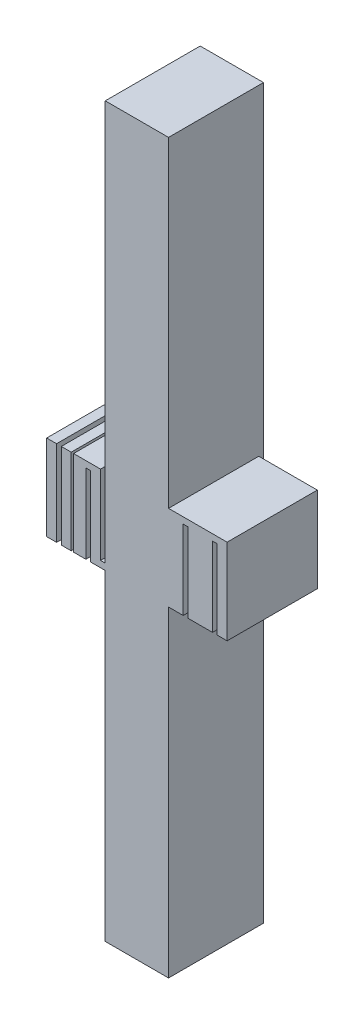
from build123d import *

# Parameters (mm, degrees)
SKETCH1_W           = 20
SKETCH1_H           = 230
BOSS_EXTRUDE1_DEPTH = 30
SKETCH2_W           = 18.5
SKETCH2_H           = 27
BOSS_EXTRUDE2_DEPTH = 28.5
SKETCH3_W           = 1.5
SKETCH3_H           = 25
CUT_EXTRUDE1_DEPTH  = 28.5
SKETCH4_W           = 1.5
SKETCH4_H           = 25
SKETCH4_W_2         = 0.75
SKETCH4_H_2         = 27
CUT_EXTRUDE2_DEPTH  = 28.5


with BuildPart() as part:
    # Sketch1 → Boss-Extrude1 (new body)
    with BuildSketch(Plane.XY):
        Rectangle(SKETCH1_W, SKETCH1_H)
    extrude(amount=-BOSS_EXTRUDE1_DEPTH)

    # Sketch2 → Boss-Extrude2 (add)
    with BuildSketch(Plane.XY):
        with Locations((-19.25, 0)):
            Rectangle(SKETCH2_W, SKETCH2_H)
        with Locations((19.25, 0)):
            Rectangle(SKETCH2_W, SKETCH2_H)
    extrude(amount=-BOSS_EXTRUDE2_DEPTH)

    # Sketch3 → Cut-Extrude1 (cut)
    with BuildSketch(Plane.XY):
        with Locations((-10.75, 1)):
            Rectangle(SKETCH3_W, SKETCH3_H)
    extrude(amount=-CUT_EXTRUDE1_DEPTH, mode=Mode.SUBTRACT)

    # Sketch4 → Cut-Extrude2 (cut)
    with BuildSketch(Plane.XY):
        with Locations((-15.375, -1)):
            Rectangle(SKETCH4_W, SKETCH4_H)
        with Locations((-20.375, 0)):
            Rectangle(SKETCH4_W_2, SKETCH4_H_2)
        with Locations((-24.625, 0)):
            Rectangle(SKETCH4_W, SKETCH4_H_2)
        with Locations((15.375, -1)):
            Rectangle(SKETCH4_W, SKETCH4_H)
        with Locations((24.625, -1)):
            Rectangle(SKETCH4_W, SKETCH4_H)
    extrude(amount=-CUT_EXTRUDE2_DEPTH, mode=Mode.SUBTRACT)


with BuildPart() as cut_extrude2_piece_1:
    # of the separate pieces the step leaves, piece 1, a body of its own (cut_extrude2_pieces)
    add(part.part.solids().sort_by_distance((-10, -115, 0))[0])


with BuildPart() as cut_extrude2_piece_2:
    # of the separate pieces the step leaves, piece 2, a body of its own (cut_extrude2_pieces)
    add(part.part.solids().sort_by_distance((-23.875, -13.5, 0))[0])


with BuildPart() as cut_extrude2_piece_3:
    # of the separate pieces the step leaves, piece 3, a body of its own (cut_extrude2_pieces)
    add(part.part.solids().sort_by_distance((-28.5, -13.5, 0))[0])


solid = Compound([cut_extrude2_piece_1.part, cut_extrude2_piece_2.part, cut_extrude2_piece_3.part])
